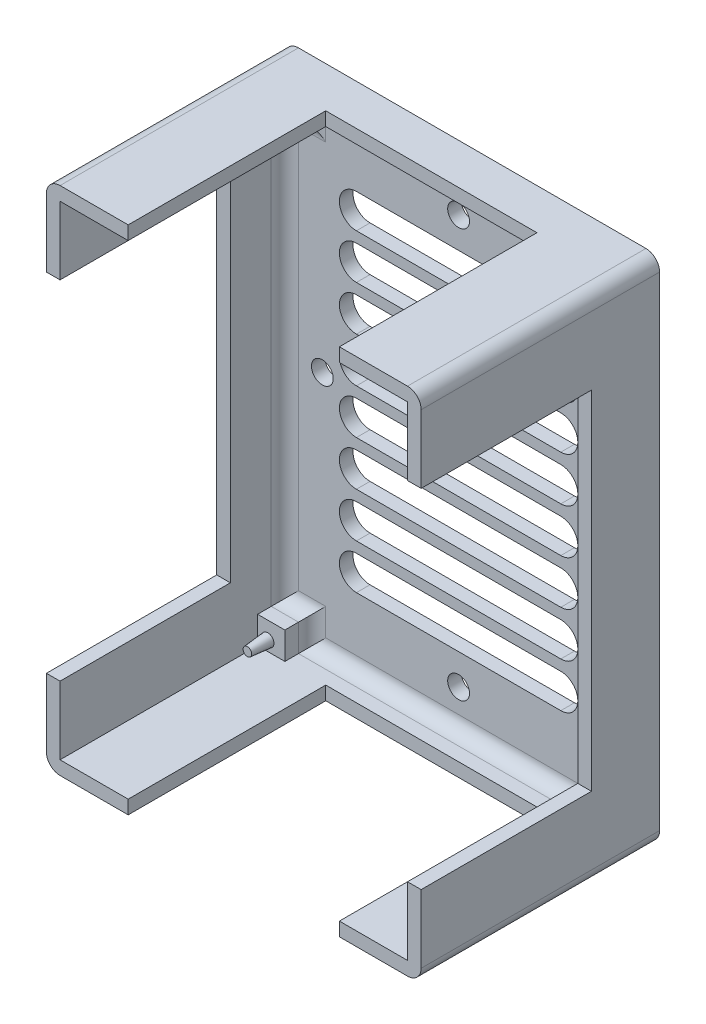
from build123d import *

# Parameters (mm, degrees)
SKETCH1_W                     = 71
SKETCH1_H                     = 51
BOSS_EXTRUDE1_DEPTH           = 33
SHELL1_T                      = 2
SKETCH3_W                     = 4
SKETCH3_H                     = 4
BOSS_EXTRUDE2_DEPTH           = 4
FILLET1_R                     = 2
CUT_EXTRUDE1_REACH            = 98.057
SKETCH4_R                     = 1.6
SKETCH5_W                     = 51
SKETCH5_H                     = 25
CUT_EXTRUDE2_DEPTH            = 98.175099691
SKETCH6_W                     = 31
SKETCH6_H                     = 29
CUT_EXTRUDE3_DEPTH            = 98.585859631
SKETCH7_R                     = 0.9
BOSS_EXTRUDE3_DEPTH           = 3
BOSS_EXTRUDE3_DRAFT           = 5
BOSS_EXTRUDE3_PROFILE_2_DEPTH = 3
BOSS_EXTRUDE3_PROFILE_2_DRAFT = 5
BOSS_EXTRUDE3_PROFILE_3_DEPTH = 3
BOSS_EXTRUDE3_PROFILE_3_DRAFT = 5
BOSS_EXTRUDE3_PROFILE_4_DEPTH = 3
BOSS_EXTRUDE3_PROFILE_4_DRAFT = 5


with BuildPart() as part:
    # Sketch1 → Boss-Extrude1 (new body)
    with BuildSketch(Plane(origin=(0, 0, 0), x_dir=(0, 1, 0), z_dir=(0, 0, 1))):
        with Locations((35.5, 25.5)):
            Rectangle(SKETCH1_W, SKETCH1_H)
    extrude(amount=BOSS_EXTRUDE1_DEPTH)

    # Shell1
    shell1_openings = [part.faces().sort_by_distance(p)[0] for p in [
        (-25.5, 35.5, 33),
    ]]
    offset(amount=SHELL1_T, openings=shell1_openings, kind=Kind.INTERSECTION)

    # Sketch3 → Boss-Extrude2 (add)
    with BuildSketch(Plane.YZ.offset(-51)):
        with Locations((2, 2)):
            Rectangle(SKETCH3_W, SKETCH3_H)
        with Locations((69, 2)):
            Rectangle(SKETCH3_W, SKETCH3_H)
    boss_extrude2 = extrude(amount=BOSS_EXTRUDE2_DEPTH)

    # Mirror1: Boss-Extrude2 across plane
    add(boss_extrude2.mirror(Plane(origin=(-25.5, 0, 0), x_dir=(0, 0, 1), z_dir=(1, 0, 0))))

    # Fillet1
    fillet1_edges = [part.edges().sort_by_distance(p)[0] for p in [
        (-25.5, 0, 0),
        (-47, 2, 0),
        (-49, 4, 0),
        (-51, 35.5, 0),
        (-49, 67, 0),
        (-47, 69, 0),
        (-25.5, 71, 0),
        (-4, 69, 0),
        (-2, 67, 0),
        (0, 35.5, 0),
        (-2, 4, 0),
        (-4, 2, 0),
        (-53, -2, 15.5),
        (2, -2, 15.5),
        (-53, 73, 15.5),
        (2, 73, 15.5),
    ]]
    fillet(fillet1_edges, radius=FILLET1_R)

    # Sketch4 → Cut-Extrude1 (cut, up to next)
    with BuildSketch(Plane.XY, mode=Mode.PRIVATE) as cut_extrude1_sk1:
        with Locations((-25.5, 5.5)):
            Circle(SKETCH4_R)
    cut_extrude1_tool1 = extrude(cut_extrude1_sk1.sketch, amount=-CUT_EXTRUDE1_REACH, mode=Mode.PRIVATE) & part.part
    # Sketch4 → Cut-Extrude1 (cut, up to next)
    with BuildSketch(Plane.XY, mode=Mode.PRIVATE) as cut_extrude1_sk2:
        with Locations((-45.5, 35.5)):
            Circle(SKETCH4_R)
    cut_extrude1_tool2 = extrude(cut_extrude1_sk2.sketch, amount=-CUT_EXTRUDE1_REACH, mode=Mode.PRIVATE) & part.part
    # Sketch4 → Cut-Extrude1 (cut, up to next)
    with BuildSketch(Plane.XY, mode=Mode.PRIVATE) as cut_extrude1_sk3:
        with Locations((-5.5, 35.5)):
            Circle(SKETCH4_R)
    cut_extrude1_tool3 = extrude(cut_extrude1_sk3.sketch, amount=-CUT_EXTRUDE1_REACH, mode=Mode.PRIVATE) & part.part
    # Sketch4 → Cut-Extrude1 (cut, up to next)
    with BuildSketch(Plane.XY, mode=Mode.PRIVATE) as cut_extrude1_sk4:
        with Locations((-25.5, 65.5)):
            Circle(SKETCH4_R)
    cut_extrude1_tool4 = extrude(cut_extrude1_sk4.sketch, amount=-CUT_EXTRUDE1_REACH, mode=Mode.PRIVATE) & part.part
    # Sketch4 → Cut-Extrude1 (cut, up to next)
    with BuildSketch(Plane.XY, mode=Mode.PRIVATE) as cut_extrude1_sk5:
        with BuildLine():
            Line((-40.5, 61), (-10.5, 61))
            ThreePointArc((-10.5, 61), (-8, 58.5), (-10.5, 56))
            Line((-10.5, 56), (-40.5, 56))
            ThreePointArc((-40.5, 56), (-43, 58.5), (-40.5, 61))
        make_face()
    cut_extrude1_tool5 = extrude(cut_extrude1_sk5.sketch, amount=-CUT_EXTRUDE1_REACH, mode=Mode.PRIVATE) & part.part
    # Sketch4 → Cut-Extrude1 (cut, up to next)
    with BuildSketch(Plane.XY, mode=Mode.PRIVATE) as cut_extrude1_sk6:
        with BuildLine():
            Line((-40.5, 54.428571429), (-10.5, 54.428571429))
            ThreePointArc((-10.5, 54.428571429), (-8, 51.928571429), (-10.5, 49.428571429))
            Line((-10.5, 49.428571429), (-40.5, 49.428571429))
            ThreePointArc((-40.5, 49.428571429), (-43, 51.928571429), (-40.5, 54.428571429))
        make_face()
    cut_extrude1_tool6 = extrude(cut_extrude1_sk6.sketch, amount=-CUT_EXTRUDE1_REACH, mode=Mode.PRIVATE) & part.part
    # Sketch4 → Cut-Extrude1 (cut, up to next)
    with BuildSketch(Plane.XY, mode=Mode.PRIVATE) as cut_extrude1_sk7:
        with BuildLine():
            Line((-40.5, 47.857142857), (-10.5, 47.857142857))
            ThreePointArc((-10.5, 47.857142857), (-8, 45.357142857), (-10.5, 42.857142857))
            Line((-10.5, 42.857142857), (-40.5, 42.857142857))
            ThreePointArc((-40.5, 42.857142857), (-43, 45.357142857), (-40.5, 47.857142857))
        make_face()
    cut_extrude1_tool7 = extrude(cut_extrude1_sk7.sketch, amount=-CUT_EXTRUDE1_REACH, mode=Mode.PRIVATE) & part.part
    # Sketch4 → Cut-Extrude1 (cut, up to next)
    with BuildSketch(Plane.XY, mode=Mode.PRIVATE) as cut_extrude1_sk8:
        with BuildLine():
            Line((-40.5, 41.285714286), (-10.5, 41.285714286))
            ThreePointArc((-10.5, 41.285714286), (-8, 38.785714286), (-10.5, 36.285714286))
            Line((-10.5, 36.285714286), (-40.5, 36.285714286))
            ThreePointArc((-40.5, 36.285714286), (-43, 38.785714286), (-40.5, 41.285714286))
        make_face()
    cut_extrude1_tool8 = extrude(cut_extrude1_sk8.sketch, amount=-CUT_EXTRUDE1_REACH, mode=Mode.PRIVATE) & part.part
    # Sketch4 → Cut-Extrude1 (cut, up to next)
    with BuildSketch(Plane.XY, mode=Mode.PRIVATE) as cut_extrude1_sk9:
        with BuildLine():
            Line((-40.5, 34.714285714), (-10.5, 34.714285714))
            ThreePointArc((-10.5, 34.714285714), (-8, 32.214285714), (-10.5, 29.714285714))
            Line((-10.5, 29.714285714), (-40.5, 29.714285714))
            ThreePointArc((-40.5, 29.714285714), (-43, 32.214285714), (-40.5, 34.714285714))
        make_face()
    cut_extrude1_tool9 = extrude(cut_extrude1_sk9.sketch, amount=-CUT_EXTRUDE1_REACH, mode=Mode.PRIVATE) & part.part
    # Sketch4 → Cut-Extrude1 (cut, up to next)
    with BuildSketch(Plane.XY, mode=Mode.PRIVATE) as cut_extrude1_sk10:
        with BuildLine():
            Line((-40.5, 28.142857143), (-10.5, 28.142857143))
            ThreePointArc((-10.5, 28.142857143), (-8, 25.642857143), (-10.5, 23.142857143))
            Line((-10.5, 23.142857143), (-40.5, 23.142857143))
            ThreePointArc((-40.5, 23.142857143), (-43, 25.642857143), (-40.5, 28.142857143))
        make_face()
    cut_extrude1_tool10 = extrude(cut_extrude1_sk10.sketch, amount=-CUT_EXTRUDE1_REACH, mode=Mode.PRIVATE) & part.part
    # Sketch4 → Cut-Extrude1 (cut, up to next)
    with BuildSketch(Plane.XY, mode=Mode.PRIVATE) as cut_extrude1_sk11:
        with BuildLine():
            Line((-40.5, 21.571428571), (-10.5, 21.571428571))
            ThreePointArc((-10.5, 21.571428571), (-8, 19.071428571), (-10.5, 16.571428571))
            Line((-10.5, 16.571428571), (-40.5, 16.571428571))
            ThreePointArc((-40.5, 16.571428571), (-43, 19.071428571), (-40.5, 21.571428571))
        make_face()
    cut_extrude1_tool11 = extrude(cut_extrude1_sk11.sketch, amount=-CUT_EXTRUDE1_REACH, mode=Mode.PRIVATE) & part.part
    # Sketch4 → Cut-Extrude1 (cut, up to next)
    with BuildSketch(Plane.XY, mode=Mode.PRIVATE) as cut_extrude1_sk12:
        with BuildLine():
            Line((-40.5, 15), (-10.5, 15))
            ThreePointArc((-10.5, 15), (-8, 12.5), (-10.5, 10))
            Line((-10.5, 10), (-40.5, 10))
            ThreePointArc((-40.5, 10), (-43, 12.5), (-40.5, 15))
        make_face()
    cut_extrude1_tool12 = extrude(cut_extrude1_sk12.sketch, amount=-CUT_EXTRUDE1_REACH, mode=Mode.PRIVATE) & part.part
    add(cut_extrude1_tool1.solids().sort_by_distance((-25.5, 5.5, 0))[0], mode=Mode.SUBTRACT)
    add(cut_extrude1_tool2.solids().sort_by_distance((-45.5, 35.5, 0))[0], mode=Mode.SUBTRACT)
    add(cut_extrude1_tool3.solids().sort_by_distance((-5.5, 35.5, 0))[0], mode=Mode.SUBTRACT)
    add(cut_extrude1_tool4.solids().sort_by_distance((-25.5, 65.5, 0))[0], mode=Mode.SUBTRACT)
    add(cut_extrude1_tool5.solids().sort_by_distance((-25.5, 58.5, 0))[0], mode=Mode.SUBTRACT)
    add(cut_extrude1_tool6.solids().sort_by_distance((-25.5, 51.928571, 0))[0], mode=Mode.SUBTRACT)
    add(cut_extrude1_tool7.solids().sort_by_distance((-25.5, 45.357143, 0))[0], mode=Mode.SUBTRACT)
    add(cut_extrude1_tool8.solids().sort_by_distance((-25.5, 38.785714, 0))[0], mode=Mode.SUBTRACT)
    add(cut_extrude1_tool9.solids().sort_by_distance((-25.5, 32.214286, 0))[0], mode=Mode.SUBTRACT)
    add(cut_extrude1_tool10.solids().sort_by_distance((-25.5, 25.642857, 0))[0], mode=Mode.SUBTRACT)
    add(cut_extrude1_tool11.solids().sort_by_distance((-25.5, 19.071429, 0))[0], mode=Mode.SUBTRACT)
    add(cut_extrude1_tool12.solids().sort_by_distance((-25.5, 12.5, 0))[0], mode=Mode.SUBTRACT)

    # Sketch5 → Cut-Extrude2 (cut, through all)
    with BuildSketch(Plane.YZ.offset(2)):
        with Locations((35.5, 20.5)):
            Rectangle(SKETCH5_W, SKETCH5_H)
    extrude(amount=-CUT_EXTRUDE2_DEPTH, mode=Mode.SUBTRACT)

    # Sketch6 → Cut-Extrude3 (cut, through all)
    with BuildSketch(Plane.XZ.offset(2)):
        with Locations((-25.5, 18.5)):
            Rectangle(SKETCH6_W, SKETCH6_H)
    extrude(amount=-CUT_EXTRUDE3_DEPTH, mode=Mode.SUBTRACT)


with BuildPart() as boss_extrude3_tool:
    # Sketch7 → Boss-Extrude3 (with draft: the straight prism first)
    with BuildSketch(Plane.XY.offset(4)):
        with Locations((-49.5, 69.5)):
            Circle(SKETCH7_R)
    extrude(amount=BOSS_EXTRUDE3_DEPTH)
    # Boss-Extrude3: the draft: its side faces are tilted about the plane it starts from
    boss_extrude3_sides = [boss_extrude3_tool.faces().sort_by_distance(p)[0] for p in [
        (-50.4, 69.5, 5.5),
    ]]
    draft(boss_extrude3_sides, Plane.XY.offset(4), BOSS_EXTRUDE3_DRAFT)


with BuildPart() as part_1:
    add(part.part)

    # Boss-Extrude3: add boss_extrude3_tool
    add(boss_extrude3_tool.part)


with BuildPart() as boss_extrude3_profile_2_tool:
    # Sketch7 → Boss-Extrude3 profile 2 (with draft: the straight prism first)
    with BuildSketch(Plane.XY.offset(4)):
        with Locations((-1.5, 69.5)):
            Circle(SKETCH7_R)
    extrude(amount=BOSS_EXTRUDE3_PROFILE_2_DEPTH)
    # Boss-Extrude3 profile 2: the draft: its side faces are tilted about the plane it starts from
    boss_extrude3_profile_2_sides = [boss_extrude3_profile_2_tool.faces().sort_by_distance(p)[0] for p in [
        (-2.4, 69.5, 5.5),
    ]]
    draft(boss_extrude3_profile_2_sides, Plane.XY.offset(4), BOSS_EXTRUDE3_PROFILE_2_DRAFT)


with BuildPart() as part_2:
    add(part_1.part)

    # Boss-Extrude3 profile 2: add boss_extrude3_profile_2_tool
    add(boss_extrude3_profile_2_tool.part)


with BuildPart() as boss_extrude3_profile_3_tool:
    # Sketch7 → Boss-Extrude3 profile 3 (with draft: the straight prism first)
    with BuildSketch(Plane.XY.offset(4)):
        with Locations((-1.5, 1.5)):
            Circle(SKETCH7_R)
    extrude(amount=BOSS_EXTRUDE3_PROFILE_3_DEPTH)
    # Boss-Extrude3 profile 3: the draft: its side faces are tilted about the plane it starts from
    boss_extrude3_profile_3_sides = [boss_extrude3_profile_3_tool.faces().sort_by_distance(p)[0] for p in [
        (-2.4, 1.5, 5.5),
    ]]
    draft(boss_extrude3_profile_3_sides, Plane.XY.offset(4), BOSS_EXTRUDE3_PROFILE_3_DRAFT)


with BuildPart() as part_3:
    add(part_2.part)

    # Boss-Extrude3 profile 3: add boss_extrude3_profile_3_tool
    add(boss_extrude3_profile_3_tool.part)


with BuildPart() as boss_extrude3_profile_4_tool:
    # Sketch7 → Boss-Extrude3 profile 4 (with draft: the straight prism first)
    with BuildSketch(Plane.XY.offset(4)):
        with Locations((-49.5, 1.5)):
            Circle(SKETCH7_R)
    extrude(amount=BOSS_EXTRUDE3_PROFILE_4_DEPTH)
    # Boss-Extrude3 profile 4: the draft: its side faces are tilted about the plane it starts from
    boss_extrude3_profile_4_sides = [boss_extrude3_profile_4_tool.faces().sort_by_distance(p)[0] for p in [
        (-50.4, 1.5, 5.5),
    ]]
    draft(boss_extrude3_profile_4_sides, Plane.XY.offset(4), BOSS_EXTRUDE3_PROFILE_4_DRAFT)


with BuildPart() as part_4:
    add(part_3.part)

    # Boss-Extrude3 profile 4: add boss_extrude3_profile_4_tool
    add(boss_extrude3_profile_4_tool.part)


solid = part_4.part
